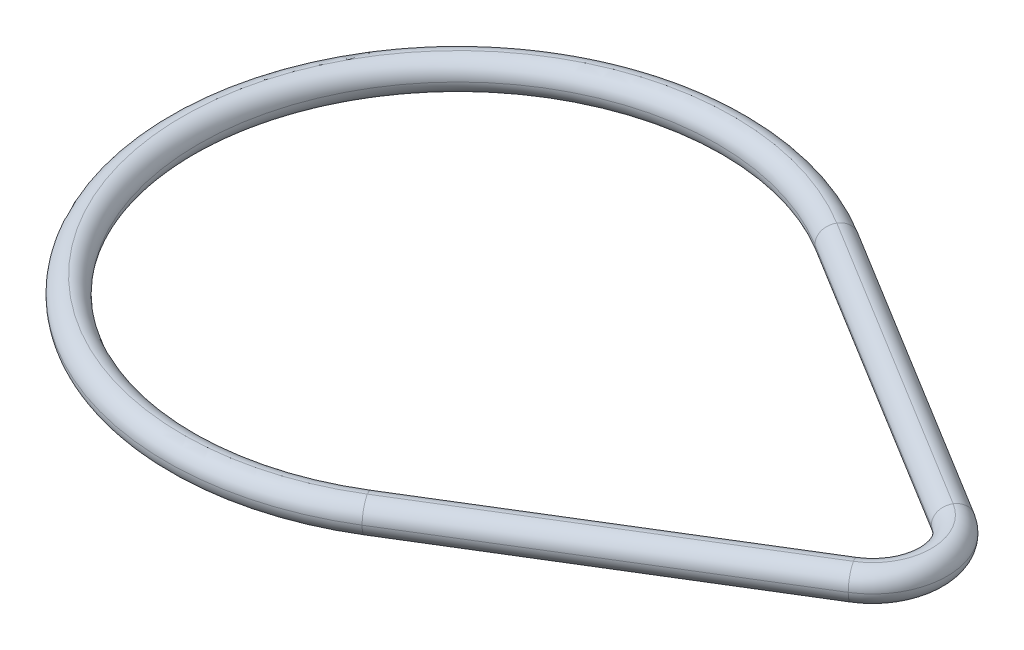
from build123d import *

# Parameters (mm, degrees)
EXTRUDE_THIN1_DEPTH = 0.75
FILLET1_R           = 0.75


with BuildPart() as part:
    # Sketch1 → Extrude-Thin1 (new, symmetric)
    with BuildSketch(Plane(origin=(0, 0, 0), x_dir=(1, 0, 0), z_dir=(0, 1, 0))):
        with BuildLine():
            Line((7.166153846, 11.676311021), (21.330769231, 2.982999166))
            ThreePointArc((21.330769231, 2.982999166), (23, 0), (21.330769231, -2.982999166))
            Line((21.330769231, -2.982999166), (7.166153846, -11.676311021))
            ThreePointArc((7.166153846, -11.676311021), (-13.7, 0), (7.166153846, 11.676311021))
        make_face()
        with BuildLine():
            Line((6.381538462, 10.397882807), (20.546153846, 1.704570952))
            ThreePointArc((20.546153846, 1.704570952), (21.5, 0), (20.546153846, -1.704570952))
            Line((20.546153846, -1.704570952), (6.381538462, -10.397882807))
            ThreePointArc((6.381538462, -10.397882807), (-12.2, 0), (6.381538462, 10.397882807))
        make_face(mode=Mode.SUBTRACT)
    extrude(amount=EXTRUDE_THIN1_DEPTH, both=True)

    # Fillet1
    fillet1_edges = [part.edges().sort_by_distance(p)[0] for p in [
        (14.248461538, 0.75, -7.329655093),
        (23, 0.75, 0),
        (14.248461538, 0.75, 7.329655093),
        (14.248461538, -0.75, -7.329655093),
        (23, -0.75, 0),
        (14.248461538, -0.75, 7.329655093),
        (13.463846154, 0.75, -6.051226879),
        (21.5, 0.75, 0),
        (13.463846154, 0.75, 6.051226879),
        (13.463846154, -0.75, -6.051226879),
        (21.5, -0.75, 0),
        (13.463846154, -0.75, 6.051226879),
        (-13.7, 0.75, 0),
        (-13.7, -0.75, 0),
        (-12.2, 0.75, 0),
        (-12.2, -0.75, 0),
    ]]
    fillet(fillet1_edges, radius=FILLET1_R - 0.0001)  # a hair under: the kernel refuses the full size


solid = part.part
